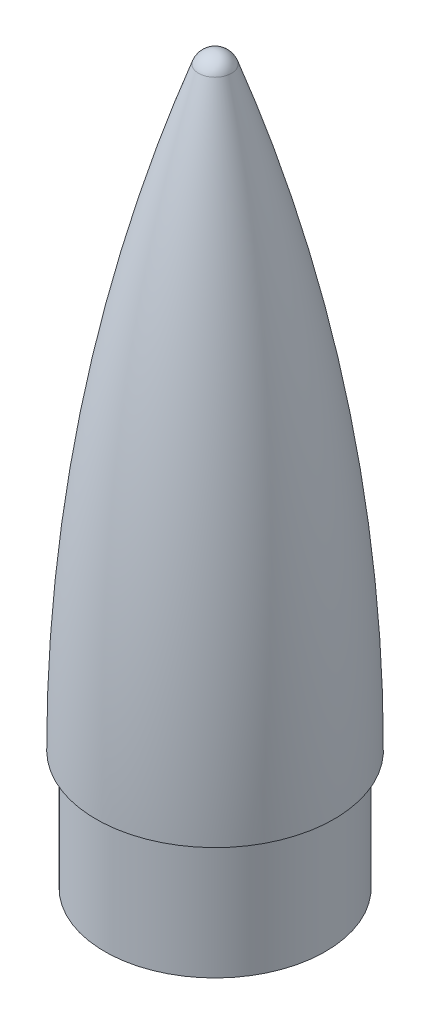
from build123d import *


with BuildPart() as part:
    # Sketch1 → Revolve3 (revolve)
    with BuildSketch(Plane.XY):
        with BuildLine():
            Line((-20.5, 0), (-19, 0))
            Line((-19, 0), (-19, -20.5))
            Line((-19, -20.5), (-17, -20.5))
            Line((-17, -20.5), (-17, 2))
            Line((-17, 2), (-18.493407361, 2))
            ThreePointArc((-18.493407361, 2), (-13.906571236, 52.59216012), (-0.942124261, 101.709660523))
            ThreePointArc((-0.942124261, 101.709660523), (-0.576513707, 102.19148411), (0, 102.374396633))
            Line((0, 102.374396633), (0, 104.374396633))
            ThreePointArc((0, 104.374396633), (-1.729541122, 103.825659064), (-2.826372784, 102.380188303))
            ThreePointArc((-2.826372784, 102.380188303), (-16.049157342, 51.947232977), (-20.5, 0))
        make_face()
    revolve(axis=Axis((0, 0, 0), (0, 1, 0)))


solid = part.part
